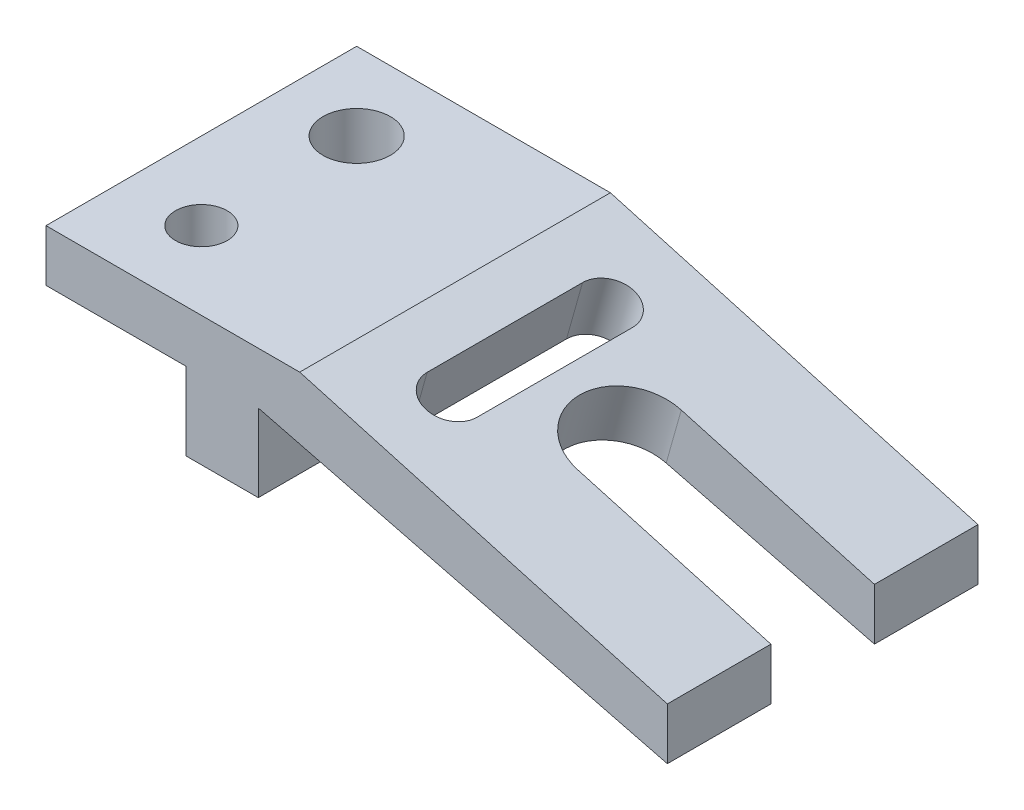
from build123d import *

# Parameters (mm, degrees)
BOSS_EXTRUDE1_START     = -73.056856187
BOSS_EXTRUDE1_OUTLINE_W = 38.1
BOSS_EXTRUDE1_OUTLINE_H = 76.2
BOSS_EXTRUDE1_DEPTH     = 152.4
SKETCH3_W               = 34.29
SKETCH3_H               = 25.4
CUT_EXTRUDE1_DEPTH      = 116.642749409
SKETCH4_W               = 17.78
SKETCH4_H               = 6.35
CUT_EXTRUDE2_DEPTH      = 116.642749409
CUT_EXTRUDE3_DEPTH      = 116.642749409
CUT_EXTRUDE4_DEPTH      = 116.642749409
CUT_EXTRUDE5_DEPTH      = 116.642749409
CUT_EXTRUDE5_DEPTH_BACK = 116.642749409
SKETCH8_R               = 6.35
CUT_EXTRUDE6_DEPTH      = 117.419003905
CUT_EXTRUDE6_DEPTH_BACK = 117.419003905
SKETCH11_R              = 8.255
CUT_EXTRUDE7_DEPTH      = 116.579441005
CUT_EXTRUDE7_DEPTH_BACK = 116.579441005
CUT_EXTRUDE9_DEPTH      = 116.579441005
CUT_EXTRUDE9_DEPTH_BACK = 116.579441005
SKETCH14_W              = 3.443454538
SKETCH14_H              = 25.4


# Read off the part's stored shape, not the designer's step: Boss-Extrude1
with BuildPart() as part:
    # Boss-Extrude1 outline → Boss-Extrude1 (new body)
    with BuildSketch(Plane.YZ.offset(BOSS_EXTRUDE1_START)):
        with Locations((-16.607692308, 38.1)):
            Rectangle(BOSS_EXTRUDE1_OUTLINE_W, BOSS_EXTRUDE1_OUTLINE_H)
    extrude(amount=BOSS_EXTRUDE1_DEPTH)

    # Sketch3 → Cut-Extrude1 (cut, through all)
    with BuildSketch(Plane.XY.offset(76.2)):
        with Locations((-55.911856187, -22.957692308)):
            Rectangle(SKETCH3_W, SKETCH3_H)
    extrude(amount=-CUT_EXTRUDE1_DEPTH, mode=Mode.SUBTRACT)

    # Sketch4 → Cut-Extrude2 (cut, through all)
    with BuildSketch(Plane.XY.offset(76.2)):
        with Locations((-29.876856187, -32.482692308)):
            Rectangle(SKETCH4_W, SKETCH4_H)
    extrude(amount=-CUT_EXTRUDE2_DEPTH, mode=Mode.SUBTRACT)

    # Sketch5 → Cut-Extrude3 (cut, through all)
    with BuildSketch(Plane.XY.offset(76.2)):
        Polygon((-20.986856187, -35.657692308), (-20.986856187, -10.257692308), (79.343143813, -35.657692308), align=None)
    extrude(amount=-CUT_EXTRUDE3_DEPTH, mode=Mode.SUBTRACT)

    # Sketch6 → Cut-Extrude4 (cut, through all)
    with BuildSketch(Plane.XY.offset(76.2)):
        Polygon((79.343143813, 2.442307692), (79.343143813, -22.957692308), (-10.826856187, 2.442307692), align=None)
    extrude(amount=-CUT_EXTRUDE4_DEPTH, mode=Mode.SUBTRACT)

    # Sketch8 → Cut-Extrude5 (cut, two sides: drawn at the far end of the back side and taken through both)
    with BuildSketch(Plane(origin=(0, 0, 0), x_dir=(1, 0, 0), z_dir=(0, 1, 0)).offset(-CUT_EXTRUDE5_DEPTH_BACK)):
        with Locations(Location((-54.006856187, -57.15, 0), (0, 0, 270))):
            Circle(SKETCH8_R)
    extrude(amount=CUT_EXTRUDE5_DEPTH + CUT_EXTRUDE5_DEPTH_BACK, mode=Mode.SUBTRACT)

    # Sketch11 → Cut-Extrude6 (cut, two sides: drawn at the far end of the back side and taken through both)
    with BuildSketch(Plane(origin=(0, 2.442307692, 0), x_dir=(1, 0, 0), z_dir=(0, 1, 0)).offset(-CUT_EXTRUDE6_DEPTH_BACK)):
        with Locations(Location((-54.006856187, -19.05, 0), (0, 0, 270))):
            Circle(SKETCH11_R)
    extrude(amount=CUT_EXTRUDE6_DEPTH + CUT_EXTRUDE6_DEPTH_BACK, mode=Mode.SUBTRACT)

    # Sketch12 → Cut-Extrude7 (cut, two sides: drawn at the far end of the back side and taken through both)
    with BuildSketch(Plane(origin=(-0.158549081, -0.562849239, 0), x_dir=(0.9625404418449637, -0.2711381526323841, 0), z_dir=(0.27113815263238417, 0.9625404418449638, 0)).offset(-CUT_EXTRUDE7_DEPTH_BACK)):
        with BuildLine():
            ThreePointArc((14.316510266, -19.05), (7.966510266, -25.4), (1.616510266, -19.05))
            Line((1.616510266, -19.05), (1.616510266, -57.15))
            ThreePointArc((1.616510266, -57.15), (7.966510266, -50.8), (14.316510266, -57.15))
            Line((14.316510266, -57.15), (14.316510266, -19.05))
        make_face()
        with BuildLine():
            ThreePointArc((14.316510266, -19.05), (7.966510266, -12.7), (1.616510266, -19.05))
            Line((1.616510266, -19.05), (14.316510266, -19.05))
        make_face()
        with BuildLine():
            Line((14.316510266, -19.05), (1.616510266, -19.05))
            ThreePointArc((1.616510266, -19.05), (7.966510266, -25.4), (14.316510266, -19.05))
        make_face()
        with BuildLine():
            ThreePointArc((14.316510266, -57.15), (7.966510266, -50.8), (1.616510266, -57.15))
            Line((1.616510266, -57.15), (14.316510266, -57.15))
        make_face()
        with BuildLine():
            Line((14.316510266, -57.15), (1.616510266, -57.15))
            ThreePointArc((1.616510266, -57.15), (7.966510266, -63.5), (14.316510266, -57.15))
        make_face()
    extrude(amount=CUT_EXTRUDE7_DEPTH + CUT_EXTRUDE7_DEPTH_BACK, mode=Mode.SUBTRACT)

    # Sketch14 → Cut-Extrude9 (cut, two sides: drawn at the far end of the back side and taken through both)
    with BuildSketch(Plane(origin=(-0.158549081, -0.562849239, 0), x_dir=(0.9625404418449637, -0.2711381526323841, 0), z_dir=(0.27113815263238417, 0.9625404418449638, 0)).offset(-CUT_EXTRUDE9_DEPTH_BACK)):
        with Locations((84.317418253, -38.1)):
            Rectangle(SKETCH14_W, SKETCH14_H)
        with BuildLine():
            Line((82.595690984, -25.4), (33.366510266, -25.4))
            ThreePointArc((33.366510266, -25.4), (42.346766387, -29.119743879), (46.066510266, -38.1))
            ThreePointArc((46.066510266, -38.1), (42.346766387, -47.080256121), (33.366510266, -50.8))
            Line((33.366510266, -50.8), (82.595690984, -50.8))
            Line((82.595690984, -50.8), (82.595690984, -25.4))
        make_face()
        with BuildLine():
            ThreePointArc((46.066510266, -38.1), (42.346766387, -29.119743879), (33.366510266, -25.4))
            Line((33.366510266, -25.4), (33.366510266, -50.8))
            ThreePointArc((33.366510266, -50.8), (42.346766387, -47.080256121), (46.066510266, -38.1))
        make_face()
        with BuildLine():
            Line((33.366510266, -50.8), (33.366510266, -25.4))
            ThreePointArc((33.366510266, -25.4), (20.666510266, -38.1), (33.366510266, -50.8))
        make_face()
    extrude(amount=CUT_EXTRUDE9_DEPTH + CUT_EXTRUDE9_DEPTH_BACK, mode=Mode.SUBTRACT)


solid = part.part
